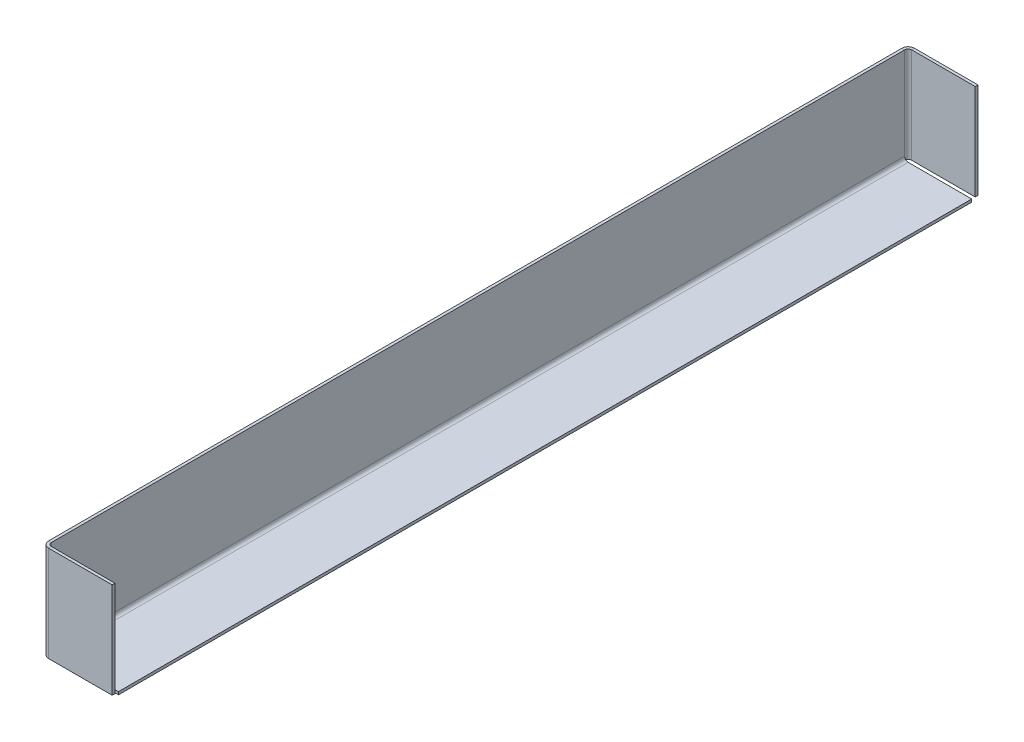
from build123d import *

# Parameters (mm, degrees)
SKETCH2_W                    = 246.4
SKETCH2_H                    = 27.4
BASE_FLANGE2_DEPTH           = 0.8
EDGE_FLANGE1_STRIP_W         = 5.2
EDGE_FLANGE1_STRIP_H         = 0.8
EDGE_FLANGE1_STRIP_CUT_DEPTH = 27.4
EDGE_FLANGE1_DEPTH           = 27.4
EDGE_FLANGE2_STRIP_W         = 5.2
EDGE_FLANGE2_STRIP_H         = 0.8
EDGE_FLANGE2_STRIP_CUT_DEPTH = 27.4
EDGE_FLANGE2_DEPTH           = 27.4
EDGE_FLANGE3_STRIP_W         = 5.2
EDGE_FLANGE3_STRIP_H         = 0.8
EDGE_FLANGE3_STRIP_CUT_DEPTH = 244.4
EDGE_FLANGE3_DEPTH           = 244.4


# Sheet-metal steps are written as plain solids
with BuildPart() as part:
    # Sketch2 → Base-Flange2 (new body)
    with BuildSketch(Plane(origin=(0, 0, 0), x_dir=(0, 0, -1), z_dir=(1, 0, 0))):
        Rectangle(SKETCH2_W, SKETCH2_H)
    extrude(amount=BASE_FLANGE2_DEPTH)

    # Edge-Flange1 strip (across the edge) → Edge-Flange1 strip cut (cut)
    with BuildSketch(Plane(origin=(0.8, 13.7, 123.2), x_dir=(0, 0, -1), z_dir=(0, -1, 0))):
        with Locations((-1.6, -0.4)):
            Rectangle(EDGE_FLANGE1_STRIP_W, EDGE_FLANGE1_STRIP_H)
    extrude(amount=EDGE_FLANGE1_STRIP_CUT_DEPTH, mode=Mode.SUBTRACT)

    # Edge-Flange1 section (across the edge) → Edge-Flange1 (add)
    with BuildSketch(Plane(origin=(0.8, 13.7, 123.2), x_dir=(0, 0, -1), z_dir=(0, -1, 0))):
        with BuildLine():
            Line((-0.8, 1), (-0.8, 19.2))
            Line((-0.8, 19.2), (0, 19.2))
            Line((0, 19.2), (0, 1))
            ThreePointArc((0, 1), (0.292893219, 0.292893219), (1, 0))
            Line((1, 0), (1, -0.8))
            ThreePointArc((1, -0.8), (-0.272792206, -0.272792206), (-0.8, 1))
        make_face()
    extrude(amount=EDGE_FLANGE1_DEPTH)

    # Edge-Flange2 strip (across the edge) → Edge-Flange2 strip cut (cut)
    with BuildSketch(Plane(origin=(0.8, -13.7, -123.2), x_dir=(0, 0, 1), z_dir=(0, 1, 0))):
        with Locations((-1.6, -0.4)):
            Rectangle(EDGE_FLANGE2_STRIP_W, EDGE_FLANGE2_STRIP_H)
    extrude(amount=EDGE_FLANGE2_STRIP_CUT_DEPTH, mode=Mode.SUBTRACT)

    # Edge-Flange2 section (across the edge) → Edge-Flange2 (add)
    with BuildSketch(Plane(origin=(0.8, -13.7, -123.2), x_dir=(0, 0, 1), z_dir=(0, 1, 0))):
        with BuildLine():
            Line((-0.8, 1), (-0.8, 19.2))
            Line((-0.8, 19.2), (0, 19.2))
            Line((0, 19.2), (0, 1))
            ThreePointArc((0, 1), (0.292893219, 0.292893219), (1, 0))
            Line((1, 0), (1, -0.8))
            ThreePointArc((1, -0.8), (-0.272792206, -0.272792206), (-0.8, 1))
        make_face()
    extrude(amount=EDGE_FLANGE2_DEPTH)

    # Edge-Flange3 strip (across the edge) → Edge-Flange3 strip cut (cut)
    with BuildSketch(Plane(origin=(0.8, -13.7, 122.2), x_dir=(0, 1, 0), z_dir=(0, 0, -1))):
        with Locations((-1.6, -0.4)):
            Rectangle(EDGE_FLANGE3_STRIP_W, EDGE_FLANGE3_STRIP_H)
    extrude(amount=EDGE_FLANGE3_STRIP_CUT_DEPTH, mode=Mode.SUBTRACT)

    # Edge-Flange3 section (across the edge) → Edge-Flange3 (add)
    with BuildSketch(Plane(origin=(0.8, -13.7, 122.2), x_dir=(0, 1, 0), z_dir=(0, 0, -1))):
        with BuildLine():
            Line((-0.8, 1), (-0.8, 19.2))
            Line((-0.8, 19.2), (0, 19.2))
            Line((0, 19.2), (0, 1))
            ThreePointArc((0, 1), (0.292893219, 0.292893219), (1, 0))
            Line((1, 0), (1, -0.8))
            ThreePointArc((1, -0.8), (-0.272792206, -0.272792206), (-0.8, 1))
        make_face()
    extrude(amount=EDGE_FLANGE3_DEPTH)


solid = part.part
